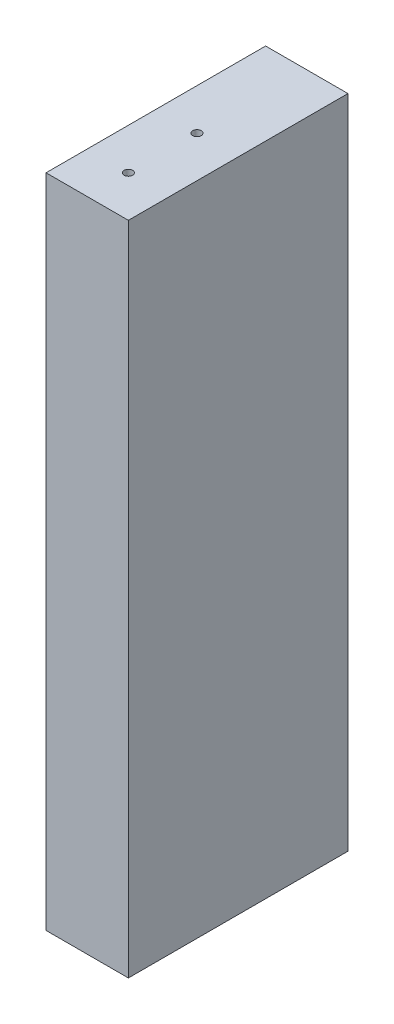
from build123d import *

# Parameters (mm, degrees)
SKETCH1_W                           = 19.05
SKETCH1_H                           = 151.8158
BOSS_EXTRUDE1_DEPTH                 = 50.8
F_5_64_0_07813_DIAMETER_HOLE1_D     = 1.984502
F_5_64_0_07813_DIAMETER_HOLE1_DEPTH = 38.1
F_5_64_0_07813_DIAMETER_HOLE1_TIP   = 0.59620455
F_5_64_0_07813_DIAMETER_HOLE2_D     = 1.984502
F_5_64_0_07813_DIAMETER_HOLE2_DEPTH = 38.1
F_5_64_0_07813_DIAMETER_HOLE2_TIP   = 0.59620455
F_5_64_0_07813_DIAMETER_HOLE3_D     = 1.984502
F_5_64_0_07813_DIAMETER_HOLE3_DEPTH = 19.05
F_5_64_0_07813_DIAMETER_HOLE3_TIP   = 0.59620455
F_5_64_0_07813_DIAMETER_HOLE4_D     = 1.984502
F_5_64_0_07813_DIAMETER_HOLE4_DEPTH = 19.05
F_5_64_0_07813_DIAMETER_HOLE4_TIP   = 0.59620455


with BuildPart() as part:
    # Sketch1 → Boss-Extrude1 (new body)
    with BuildSketch(Plane.XY):
        with Locations((452.446826131, 6526.2379)):
            Rectangle(SKETCH1_W, SKETCH1_H)
    extrude(amount=BOSS_EXTRUDE1_DEPTH)

    # 5/64 (0.07813) Diameter Hole1
    with Locations(Plane(origin=(5.615513709, 0, -19.05), x_dir=(-1, 0, 0), z_dir=(0, 0, -1))):
        with Locations((-481.589248274, 6993.254992531), (-386.339248274, 6993.254992531), (-291.089248274, 6993.254992531), (-295.274999999, 6965.135938474), (-295.274999999, 6812.735938474), (-295.274999999, 6660.335938474), (-285.166362357, 6631.468843414), (-475.477307398, 6631.468752771), (-485.002307398, 6660.335938474), (-485.002307398, 6812.735938474), (-485.002307398, 6965.135938474), (-478.365617646, 6611.6708), (-287.865617646, 6611.6708), (-307.975, 6564.3379), (-307.975, 6488.1379), (-284.960913066, 6440.805), (-380.210913066, 6440.805), (-475.460913066, 6440.805), (-446.831312422, 6488.1379), (-446.831312422, 6564.3379), (-472.231312422, 6396.355), (-472.231312422, 6320.155), (-472.653156211, 6275.705000839), (-377.403156211, 6275.705000839), (-282.153156211, 6275.705000839), (-282.575, 6320.155), (-282.575, 6396.355), (-435.598646187, 6221.729999816), (-435.598646187, 6145.529999816), (-450.592518112, 6091.554999951), (-460.998646187, 6091.555478285), (-460.998646187, 6056.629999944), (-460.998646187, 5980.429999944), (-460.998646187, 5945.505000042), (-282.153156211, 5945.505000042), (-368.611823093, 5945.505000042)):
            Hole(F_5_64_0_07813_DIAMETER_HOLE1_D / 2, depth=F_5_64_0_07813_DIAMETER_HOLE1_DEPTH)
            with Locations((0, 0, -(F_5_64_0_07813_DIAMETER_HOLE1_DEPTH + F_5_64_0_07813_DIAMETER_HOLE1_TIP / 2))):  # 118° drill point
                Cone(0, F_5_64_0_07813_DIAMETER_HOLE1_D / 2, F_5_64_0_07813_DIAMETER_HOLE1_TIP, mode=Mode.SUBTRACT)

    # 5/64 (0.07813) Diameter Hole2
    with Locations(Plane(origin=(144.471826131, 0, -19.05), x_dir=(-1, 0, 0), z_dir=(0, 0, -1))):
        with Locations((-481.589248274, 6993.254992531), (-386.339248274, 6993.254992531), (-291.089248274, 6993.254992531), (-295.274999999, 6965.135938474), (-295.274999999, 6812.735938474), (-295.274999999, 6660.335938474), (-285.166362357, 6631.468843414), (-475.477307398, 6631.468752771), (-485.002307398, 6660.335938474), (-485.002307398, 6812.735938474), (-485.002307398, 6965.135938474), (-478.365617646, 6611.6708), (-287.865617646, 6611.6708), (-307.975, 6564.3379), (-307.975, 6488.1379), (-284.960913066, 6440.805), (-380.210913066, 6440.805), (-475.460913066, 6440.805), (-446.831312422, 6488.1379), (-446.831312422, 6564.3379), (-472.231312422, 6396.355), (-472.231312422, 6320.155), (-472.653156211, 6275.705000839), (-377.403156211, 6275.705000839), (-282.153156211, 6275.705000839), (-282.575, 6320.155), (-282.575, 6396.355), (-435.598646187, 6221.729999816), (-435.598646187, 6145.529999816), (-450.592518112, 6091.554999951), (-460.998646187, 6091.555478285), (-460.998646187, 6056.629999944), (-460.998646187, 5980.429999944), (-460.998646187, 5945.505000042), (-282.153156211, 5945.505000042), (-368.611823093, 5945.505000042)):
            Hole(F_5_64_0_07813_DIAMETER_HOLE2_D / 2, depth=F_5_64_0_07813_DIAMETER_HOLE2_DEPTH)
            with Locations((0, 0, -(F_5_64_0_07813_DIAMETER_HOLE2_DEPTH + F_5_64_0_07813_DIAMETER_HOLE2_TIP / 2))):  # 118° drill point
                Cone(0, F_5_64_0_07813_DIAMETER_HOLE2_D / 2, F_5_64_0_07813_DIAMETER_HOLE2_TIP, mode=Mode.SUBTRACT)

    # 5/64 (0.07813) Diameter Hole3
    with Locations(Plane(origin=(0, 6602.1458, 0), x_dir=(1, 0, 0), z_dir=(0, 1, 0))):
        with Locations((452.446826131, -41.275), (452.446826131, -25.4)):
            Hole(F_5_64_0_07813_DIAMETER_HOLE3_D / 2, depth=F_5_64_0_07813_DIAMETER_HOLE3_DEPTH)
            with Locations((0, 0, -(F_5_64_0_07813_DIAMETER_HOLE3_DEPTH + F_5_64_0_07813_DIAMETER_HOLE3_TIP / 2))):  # 118° drill point
                Cone(0, F_5_64_0_07813_DIAMETER_HOLE3_D / 2, F_5_64_0_07813_DIAMETER_HOLE3_TIP, mode=Mode.SUBTRACT)

    # 5/64 (0.07813) Diameter Hole4
    with Locations(Plane(origin=(0, 6450.33, 0), x_dir=(-1, 0, 0), z_dir=(0, -1, 0))):
        with Locations((-452.446826131, -41.275), (-452.446826131, -25.4)):
            Hole(F_5_64_0_07813_DIAMETER_HOLE4_D / 2, depth=F_5_64_0_07813_DIAMETER_HOLE4_DEPTH)
            with Locations((0, 0, -(F_5_64_0_07813_DIAMETER_HOLE4_DEPTH + F_5_64_0_07813_DIAMETER_HOLE4_TIP / 2))):  # 118° drill point
                Cone(0, F_5_64_0_07813_DIAMETER_HOLE4_D / 2, F_5_64_0_07813_DIAMETER_HOLE4_TIP, mode=Mode.SUBTRACT)


solid = part.part
